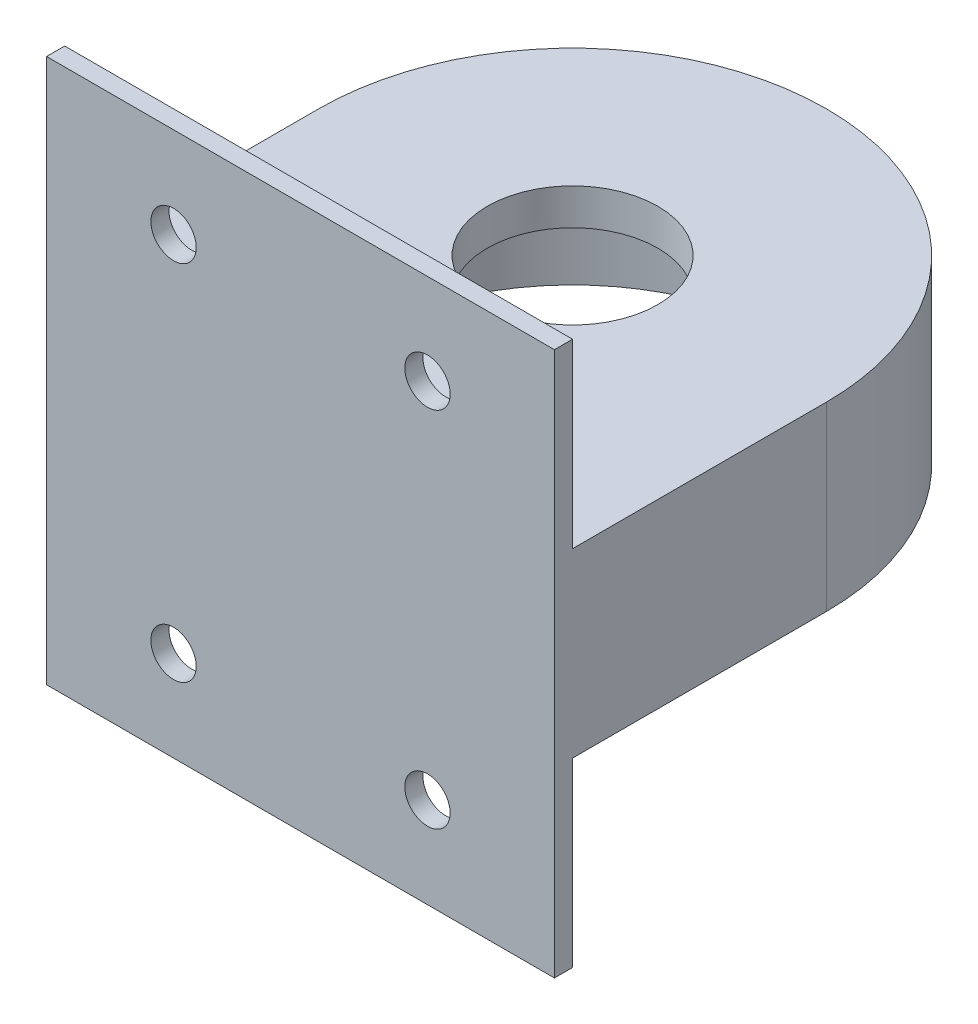
from build123d import *

# Parameters (mm, degrees)
SKETCH1_R                   = 4.7
BOSS_EXTRUDE1_DEPTH         = 10
SKETCH2_W                   = 28
SKETCH2_H                   = 30
BOSS_EXTRUDE2_DEPTH         = 1
TAP_DRILL_FOR_M3X0_5_TAP1_D = 2.5
SKETCH5_R                   = 12.15
SKETCH5_R_2                 = 4.7
CUT_EXTRUDE1_DEPTH          = 8


with BuildPart() as part:
    # Sketch1 → Boss-Extrude1 (new body)
    with BuildSketch(Plane(origin=(0, 0, 0), x_dir=(1, 0, 0), z_dir=(0, 1, 0))):
        with BuildLine():
            Line((0, 1.238241861), (0, 15.238241861))
            ThreePointArc((0, 15.238241861), (-14, 29.238241861), (-28, 15.238241861))
            Line((-28, 15.238241861), (-28, 1.238241861))
            Line((-28, 1.238241861), (0, 1.238241861))
        make_face()
        with Locations((-14, 15.238241861)):
            Circle(SKETCH1_R, mode=Mode.SUBTRACT)
    extrude(amount=BOSS_EXTRUDE1_DEPTH)

    # Sketch2 → Boss-Extrude2 (add)
    with BuildSketch(Plane.XY.offset(-1.238241861)):
        with Locations((-14, 5)):
            Rectangle(SKETCH2_W, SKETCH2_H)
    extrude(amount=BOSS_EXTRUDE2_DEPTH)

    # Tap Drill for M3x0.5 Tap1 (through all)
    with Locations(Plane(origin=(0, 0, -1.238241861), x_dir=(-1, 0, 0), z_dir=(0, 0, -1))):
        with Locations((7, 15), (21, 15), (7, -5), (21, -5)):
            Hole(TAP_DRILL_FOR_M3X0_5_TAP1_D / 2)

    # Sketch5 → Cut-Extrude1 (cut)
    with BuildSketch(Plane.XZ):
        with Locations((-14, -15.238241861)):
            Circle(SKETCH5_R)
        with Locations((-14, -15.238241861)):
            Circle(SKETCH5_R_2, mode=Mode.SUBTRACT)
    extrude(amount=-CUT_EXTRUDE1_DEPTH, mode=Mode.SUBTRACT)


solid = part.part
